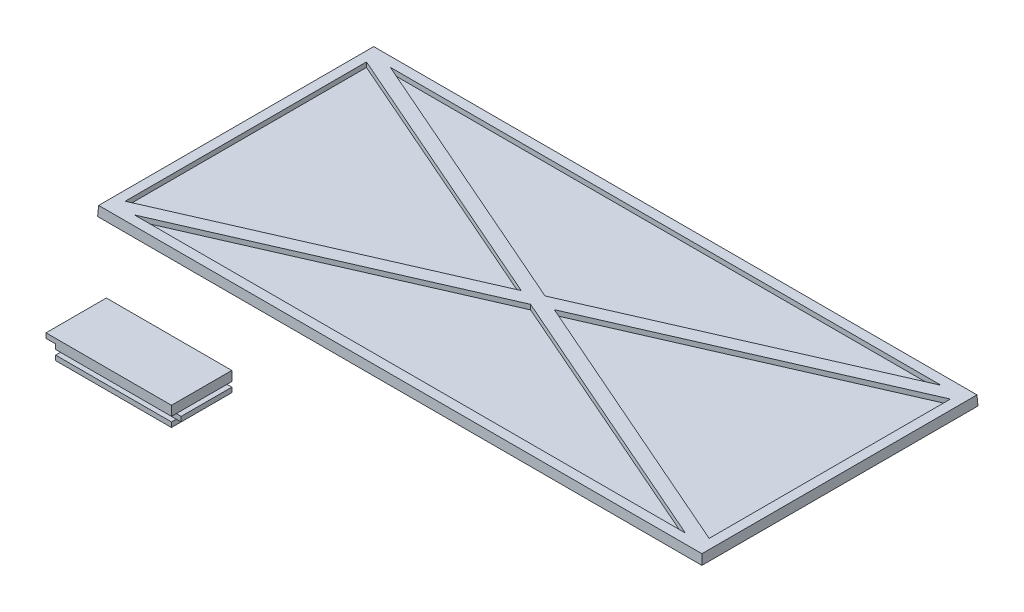
from build123d import *

# Parameters (mm, degrees)
SKETCH1_W           = 128
SKETCH1_H           = 60
BOSS_EXTRUDE1_DEPTH = 2
GROOVE2_START       = -32.037780401
GROOVE2_OUTLINE_W   = 128
GROOVE2_OUTLINE_H   = 2
GROOVE2_DEPTH       = 1.395184441
GROOVE2_START_2     = 26.567035157
GROOVE2_2_OUTLINE_W = 128
GROOVE2_2_OUTLINE_H = 2
GROOVE2_2_DEPTH     = 1.395184442
GROOVE2_3_DEPTH     = 60
GROOVE2_START_3     = -64
GROOVE2_4_DEPTH     = 127
CUT_EXTRUDE1_DEPTH  = 1
SKETCH6_W           = 26
SKETCH6_H           = 12.5
BOSS_EXTRUDE2_DEPTH = 4
SKETCH7_W           = 26
SKETCH7_H           = 1
CUT_EXTRUDE2_DEPTH  = 1
SKETCH8_W           = 26
SKETCH8_H           = 1
CUT_EXTRUDE3_DEPTH  = 1
SKETCH10_W          = 10.5
SKETCH10_H          = 1
BOSS_EXTRUDE3_DEPTH = 1
SKETCH11_W          = 12.5
SKETCH11_H          = 3
CUT_EXTRUDE4_DEPTH  = 2


with BuildPart() as part:
    # Sketch1 → Boss-Extrude1 (new body)
    with BuildSketch(Plane(origin=(0, 0, 0), x_dir=(1, 0, 0), z_dir=(0, 1, 0))):
        with Locations((-0.377804014, 2.037780401)):
            Rectangle(SKETCH1_W, SKETCH1_H)
    extrude(amount=BOSS_EXTRUDE1_DEPTH)

    # Groove2: read off the stored shape, not the designer's step
    # Groove2 outline → Groove2 (cut)
    with BuildSketch(Plane.XY.offset(GROOVE2_START)):
        with Locations((-0.377804014, 1)):
            Rectangle(GROOVE2_OUTLINE_W, GROOVE2_OUTLINE_H)
    extrude(amount=GROOVE2_DEPTH, mode=Mode.SUBTRACT)

    # Groove2 2 outline → Groove2 2 (cut)
    with BuildSketch(Plane.XY.offset(GROOVE2_START_2)):
        with Locations((-0.377804014, 1)):
            Rectangle(GROOVE2_2_OUTLINE_W, GROOVE2_2_OUTLINE_H)
    extrude(amount=GROOVE2_2_DEPTH, mode=Mode.SUBTRACT)

    # Groove2 3 outline → Groove2 3 (cut)
    with BuildSketch(Plane.XY.offset(GROOVE2_START)):
        Polygon((63.622195986, 2), (62.122195986, 2), (62.227011544, 0), (63.622195986, 0), align=None)
        Polygon((-62.982619573, 0), (-62.877804014, 2), (-64.377804014, 2), (-64.377804014, 0), align=None)
    extrude(amount=GROOVE2_3_DEPTH, mode=Mode.SUBTRACT)

    # Groove2 4 outline → Groove2 4 (cut)
    with BuildSketch(Plane.YZ.offset(GROOVE2_START_3)):
        Polygon((2, 26.567035157), (0, 26.567035157), (2, 26.462219599), align=None)
        Polygon((2, -30.64259596), (2, -30.537780401), (0, -30.64259596), align=None)
    extrude(amount=GROOVE2_4_DEPTH, mode=Mode.SUBTRACT)

    # Sketch4 → Cut-Extrude1 (cut)
    with BuildSketch(Plane(origin=(0, 2, 0), x_dir=(1, 0, 0), z_dir=(0, 1, 0))):
        Polygon((-57.453275712, -24.462219599), (56.697667684, -24.462219599), (-0.377804014, 0.537780401), align=None)
        Polygon((-60.877804014, -22.962219599), (-60.877804014, 27.037780401), (-3.802332316, 2.037780401), align=None)
        Polygon((-57.453275712, 28.537780401), (56.697667684, 28.537780401), (-0.377804014, 3.537780401), align=None)
        Polygon((60.122195986, -22.962219599), (60.122195986, 27.037780401), (3.046724288, 2.037780401), align=None)
    extrude(amount=-CUT_EXTRUDE1_DEPTH, mode=Mode.SUBTRACT)


with BuildPart() as body_2:
    # Sketch6 → Boss-Extrude2 (new body)
    with BuildSketch(Plane(origin=(0, 0, 0), x_dir=(1, 0, 0), z_dir=(0, 1, 0))):
        with Locations((-30.467681851, -50.528824738)):
            Rectangle(SKETCH6_W, SKETCH6_H)
    extrude(amount=BOSS_EXTRUDE2_DEPTH)

    # Sketch7 → Cut-Extrude2 (cut)
    with BuildSketch(Plane.XY.offset(56.778824738)):
        with Locations((-30.467681851, 1.5)):
            Rectangle(SKETCH7_W, SKETCH7_H)
    extrude(amount=-CUT_EXTRUDE2_DEPTH, mode=Mode.SUBTRACT)

    # Sketch8 → Cut-Extrude3 (cut)
    with BuildSketch(Plane(origin=(0, 0, 44.278824738), x_dir=(-1, 0, 0), z_dir=(0, 0, -1))):
        with Locations((30.467681851, 1.5)):
            Rectangle(SKETCH8_W, SKETCH8_H)
    extrude(amount=-CUT_EXTRUDE3_DEPTH, mode=Mode.SUBTRACT)

    # Sketch10 → Boss-Extrude3 (add)
    with BuildSketch(Plane(origin=(-17.467681851, 0, 0), x_dir=(0, 0, -1), z_dir=(1, 0, 0))):
        with Locations((-50.528824738, 1.5)):
            Rectangle(SKETCH10_W, SKETCH10_H)
    extrude(amount=BOSS_EXTRUDE3_DEPTH)

    # Sketch11 → Cut-Extrude4 (cut)
    with BuildSketch(Plane.ZY.offset(43.467681851)):
        with Locations((50.528824738, 1.5)):
            Rectangle(SKETCH11_W, SKETCH11_H)
    extrude(amount=-CUT_EXTRUDE4_DEPTH, mode=Mode.SUBTRACT)


solid = Compound([part.part, body_2.part])
